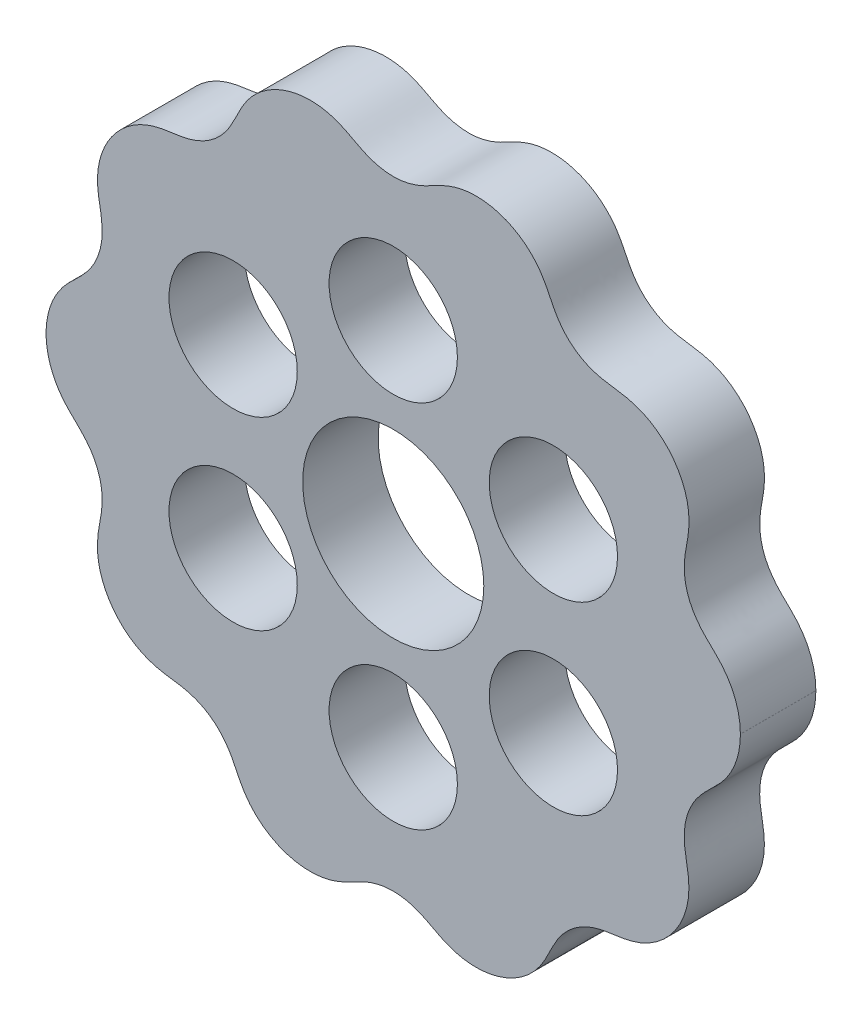
from build123d import *

# Parameters (mm, degrees)
BOSS_EXTRUDE1_DEPTH = 10
SKETCH2_R           = 8.5
SKETCH2_R_2         = 12
CUT_EXTRUDE1_DEPTH  = 10


# Read off the part's stored shape, not the designer's step: Boss-Extrude1
with BuildPart() as part:
    # Boss-Extrude1 outline → Boss-Extrude1 (new body)
    with BuildSketch(Plane.XY):
        with BuildLine():
            Line((45.999967847, -0.000808009), (45.999980979, 0.015150179))
            add(Edge.make_bspline(
                [(45.999980979, 0.015150179), (45.999909177, 0.043993275), (45.999533344, 0.092527615), (45.996854288, 0.26279134), (45.989395984, 0.511474453), (45.961346287, 0.964032972), (45.848010896, 1.928814687), (45.530838309, 3.24002273), (45.014894425, 4.484458229), (44.490203238, 5.414362), (44.040153464, 6.081697781), (43.52883506, 6.72519972), (43.03282734, 7.26431222), (42.556271955, 7.739280426), (42.124520249, 8.154065614), (41.570291561, 8.68967561), (40.906683081, 9.367491121), (40.173804604, 10.29356743), (39.560306261, 11.259421942), (38.995026481, 12.534542401), (38.657221475, 13.907340804), (38.554568486, 15.100977668), (38.587226765, 16.338371238), (38.726472717, 17.321095395), (38.862951715, 18.102405041), (38.970596798, 18.701092374), (39.052878567, 19.207851434), (39.135203938, 19.817778804), (39.193879544, 20.519678165), (39.200580554, 21.331321943), (39.143493661, 22.1306232), (38.982460709, 23.188133209), (38.622204628, 24.48640555), (37.944032589, 25.972584234), (37.039645341, 27.3414096), (35.93571982, 28.552474925), (34.665498832, 29.569797005), (33.499353595, 30.232659866), (32.51318542, 30.646101049), (31.746496478, 30.898075865), (30.928479523, 31.099228117), (30.177846556, 31.230700456), (29.414474723, 31.33806881), (28.701985949, 31.436495426), (27.84024195, 31.573845081), (26.820626562, 31.826888467), (25.838990356, 32.163305358), (24.662437059, 32.747964599), (23.504997603, 33.593007178), (22.591610581, 34.531924102), (21.772859937, 35.632013235), (21.239197537, 36.601197154), (20.862690475, 37.362728871), (20.587934907, 37.933016875), (20.27281516, 38.564369388), (19.916992674, 39.210623217), (19.465324173, 39.908992744), (18.978101745, 40.547585947), (18.442269866, 41.144650835), (17.6659664, 41.88154187), (16.582794133, 42.688378623), (15.134300839, 43.448289509), (13.58064433, 43.976350272), (11.967554224, 44.256915327), (10.614562099, 44.277932334), (9.548563777, 44.167343791), (8.759617074, 44.021057793), (7.985360328, 43.812563937), (7.215390848, 43.538319409), (6.558166399, 43.248361222), (5.981496328, 42.960692325), (5.493841027, 42.703386841), (4.881370359, 42.374313072), (4.043141573, 41.943977458), (2.819391337, 41.417606362), (1.260590771, 41.057202561), (-0.160841601, 40.960914901), (-1.535289477, 41.108637274), (-3.012575203, 41.49628454), (-4.137215587, 41.999777114), (-4.951720989, 42.421016744), (-5.533815758, 42.73494367), (-6.019337511, 42.989639414), (-6.589256211, 43.272106319), (-7.24313542, 43.55790297), (-8.014518722, 43.829000377), (-8.788845639, 44.03410691), (-9.578356934, 44.177062535), (-10.645151775, 44.283201632), (-11.998484636, 44.256618767), (-13.610648206, 43.969391712), (-15.162072329, 43.435081512), (-16.607284396, 42.669306079), (-17.686651175, 41.858334377), (-18.459642004, 41.118402865), (-18.993353295, 40.518625895), (-19.47785039, 39.878176776), (-19.927689091, 39.176582082), (-20.286146916, 38.520458945), (-20.600937017, 37.886416192), (-20.889081539, 37.288431925), (-21.277947915, 36.508345421), (-21.862330058, 35.473772303), (-22.757395347, 34.33340296), (-23.741957942, 33.391707519), (-24.926350035, 32.598212712), (-26.455787523, 31.905671864), (-27.803748907, 31.588306389), (-28.781781286, 31.432442151), (-29.475295234, 31.338869834), (-30.220519967, 31.232498276), (-30.966762182, 31.09969987), (-31.779857945, 30.896312301), (-32.545667663, 30.641186196), (-33.529382914, 30.223873985), (-34.693428516, 29.555788974), (-35.95963583, 28.533062778), (-37.058828978, 27.317277783), (-37.957522874, 25.944988268), (-38.629545092, 24.456156787), (-38.984206609, 23.156992822), (-39.140782965, 22.099068159), (-39.19459519, 21.298300118), (-39.184569333, 20.487909109), (-39.122921742, 19.781472122), (-39.037813564, 19.165346332), (-38.954143147, 18.656351085), (-38.841672749, 18.034965373), (-38.703691185, 17.228825261), (-38.563697037, 16.183296026), (-38.557936212, 14.864330444), (-38.704996539, 13.61944065), (-39.10477547, 12.236615358), (-39.69767808, 11.025919277), (-40.303468868, 10.127710565), (-41.005300019, 9.273039657), (-41.640690849, 8.632055422), (-42.174585459, 8.11830209), (-42.597256258, 7.71125793), (-43.067093697, 7.240843994), (-43.556227089, 6.705369209), (-44.066142184, 6.058533083), (-44.511686873, 5.391787911), (-45.033286281, 4.458008497), (-45.543743939, 3.214614794), (-45.91835428, 1.627153593), (-46.042364578, -0.008021821), (-45.912074809, -1.642660378), (-45.531454936, -3.228106152), (-45.016166243, -4.469261795), (-44.490948965, -5.400854029), (-44.04258997, -6.066038069), (-43.528660211, -6.713019947), (-43.036376726, -7.248448355), (-42.556422655, -7.726940173), (-42.126761597, -8.14020624), (-41.572000631, -8.676219906), (-40.904483147, -9.359999318), (-40.1760299, -10.281157695), (-39.558186524, -11.257131148), (-38.998220633, -12.524271934), (-38.659730437, -13.907384538), (-38.56006984, -15.090518607), (-38.592953656, -16.330455653), (-38.733471344, -17.311133438), (-38.868774447, -18.088432278), (-38.978074098, -18.69267491), (-39.05954078, -19.194432285), (-39.142098023, -19.804716519), (-39.201090693, -20.508941643), (-39.207949717, -21.317977576), (-39.150980992, -22.11852837), (-38.990186166, -23.175860629), (-38.630289044, -24.474108069), (-37.952371262, -25.960618853), (-37.0483698, -27.329533944), (-35.944635713, -28.540938483), (-34.674838032, -29.55843213), (-33.508411895, -30.221742609), (-32.52309764, -30.635132283), (-31.755255677, -30.887620613), (-30.939109877, -31.088606299), (-30.18545086, -31.220710702), (-29.425012376, -31.327973897), (-28.708580821, -31.427210986), (-27.847930179, -31.564712407), (-26.825849411, -31.819355599), (-25.844278949, -32.156720519), (-24.667177304, -32.743345587), (-23.50884523, -33.591542446), (-22.599888837, -34.528939023), (-21.783463691, -35.626864928), (-21.248740999, -36.600402323), (-20.877546028, -37.351200574), (-20.597847536, -37.932468904), (-20.287439747, -38.554902416), (-19.929320839, -39.20572596), (-19.478336401, -39.903434065), (-18.991583524, -40.541643202), (-18.455548488, -41.139233057), (-17.679472505, -41.876241382), (-16.596570231, -42.683245596), (-15.14816033, -43.443567037), (-13.5946696, -43.971938362), (-11.981644269, -44.252909595), (-10.628638345, -44.274199269), (-9.562562587, -44.163869765), (-8.773623789, -44.017772577), (-7.999930251, -43.809561909), (-7.228185918, -43.535020293), (-6.572022217, -43.245577556), (-5.996493759, -42.958537082), (-5.501632769, -42.698065587), (-4.901273807, -42.374985207), (-4.046701236, -41.938030242), (-2.836499421, -41.416426058), (-1.260148882, -41.054657075), (0.149462446, -40.961162928), (1.533141558, -41.111240417), (2.998599047, -41.498298527), (4.126260933, -42.002539841), (4.938798625, -42.423842851), (5.521241673, -42.73791555), (6.005751107, -42.992421134), (6.575391284, -43.274880963), (7.229663727, -43.560995633), (8.000258598, -43.832064602), (8.774876645, -44.037410225), (9.564293658, -44.180537137), (10.631060354, -44.286925077), (11.984428474, -44.260632272), (13.596623528, -43.973797386), (15.148230137, -43.439802008), (16.593519526, -42.674429787), (17.673156757, -41.863629935), (18.446384378, -41.123798314), (18.979842202, -40.524610603), (19.464925669, -39.883610966), (19.915310924, -39.18157966), (20.271349682, -38.530187302), (20.591422064, -37.886349523), (20.873541557, -37.301040869), (21.269809537, -36.507252338), (21.849891553, -35.48113889), (22.751853926, -34.333929258), (23.736159657, -33.395453618), (24.923834158, -32.601913158), (26.448141575, -31.914290533), (27.796346597, -31.597038542), (28.774592629, -31.441966708), (29.465423577, -31.348848968), (30.212336316, -31.242606139), (30.956316144, -31.110287953), (31.771032011, -30.906787396), (32.535791405, -30.652144727), (33.520317422, -30.23479375), (34.68410196, -29.567148415), (35.950728891, -28.544590947), (37.050111735, -27.329146349), (37.949193926, -25.956936574), (38.62146364, -24.46845069), (38.976486512, -23.169239427), (39.133299556, -22.111161207), (39.187221915, -21.311617782), (39.17737517, -20.498644637), (39.11599281, -19.794293066), (39.031202755, -19.179101293), (38.946497542, -18.663541503), (38.836189495, -18.050970772), (38.696453477, -17.236882881), (38.558120927, -16.191278403), (38.552599196, -14.874260749), (38.703038155, -13.61948214), (39.102413592, -12.245846031), (39.698557707, -11.03131911), (40.303052556, -10.137733066), (41.00525566, -9.283707901), (41.63893825, -8.645318438), (42.173725818, -8.130950151), (42.59591854, -7.724754571), (43.064470707, -7.255759028), (43.556058878, -6.718001209), (44.063792505, -6.074001771), (44.510962386, -5.405378474), (45.03198856, -4.472847368), (45.543025631, -3.229851698), (45.85573588, -1.903704468), (45.956628637, -1.029353519), (45.984186766, -0.614823429), (45.992944281, -0.429132939), (45.997835063, -0.241871794), (45.999852056, -0.076936406), (45.999998127, -0.02906758), (45.999967847, -0.000808009)],
                knots=[0.072195174, 0.072195174, 0.072195174, 0.072195174, 0.072612982, 0.073030789, 0.073866404, 0.075537634, 0.078880093, 0.085565011, 0.09224993, 0.095592389, 0.098934848, 0.102277307, 0.105619767, 0.107290996, 0.108962226, 0.110633455, 0.112304685, 0.1131403, 0.113975915, 0.114811529, 0.115647144, 0.116482759, 0.117318374, 0.118989603, 0.120660833, 0.122332063, 0.124003292, 0.125674522, 0.129016981, 0.13235944, 0.135701899, 0.139044359, 0.145729277, 0.152414196, 0.159099114, 0.165784032, 0.172468951, 0.179153869, 0.182496328, 0.185838788, 0.189181247, 0.192523706, 0.194194936, 0.195866165, 0.197537395, 0.19837301, 0.199208625, 0.200044239, 0.200879854, 0.201715469, 0.202551084, 0.204222313, 0.205893543, 0.207564773, 0.209236002, 0.212578461, 0.215920921, 0.21926338, 0.222605839, 0.225948298, 0.232633217, 0.239318135, 0.246003054, 0.252687972, 0.25937289, 0.26271535, 0.266057809, 0.269400268, 0.272742727, 0.276085186, 0.277756416, 0.279427646, 0.281098875, 0.282770105, 0.284441334, 0.285276949, 0.286112564, 0.286948179, 0.287783794, 0.289455023, 0.291126253, 0.292797483, 0.294468712, 0.296139942, 0.299482401, 0.30282486, 0.306167319, 0.309509779, 0.312852238, 0.319537156, 0.326222075, 0.332906993, 0.339591912, 0.34627683, 0.349619289, 0.352961748, 0.356304208, 0.359646667, 0.362989126, 0.364660356, 0.366331585, 0.368002815, 0.369674044, 0.370509659, 0.371345274, 0.372180889, 0.373016504, 0.374687733, 0.376358963, 0.378030192, 0.379701422, 0.383043881, 0.38638634, 0.3897288, 0.393071259, 0.399756177, 0.406441096, 0.413126014, 0.419810933, 0.426495851, 0.433180769, 0.436523229, 0.439865688, 0.443208147, 0.446550606, 0.448221836, 0.449893066, 0.451564295, 0.453235525, 0.454906754, 0.455742369, 0.456577984, 0.457413599, 0.458249214, 0.459084828, 0.459920443, 0.461591673, 0.463262902, 0.464934132, 0.466605362, 0.469947821, 0.47329028, 0.476632739, 0.479975198, 0.486660117, 0.493345035, 0.500029954, 0.506714872, 0.513399791, 0.520084709, 0.523427168, 0.526769627, 0.530112087, 0.533454546, 0.535125776, 0.536797005, 0.538468235, 0.540139464, 0.540975079, 0.541810694, 0.542646309, 0.543481924, 0.544317538, 0.545153153, 0.546824383, 0.548495612, 0.550166842, 0.551838072, 0.553509301, 0.55685176, 0.56019422, 0.563536679, 0.566879138, 0.573564056, 0.580248975, 0.586933893, 0.593618812, 0.60030373, 0.606988649, 0.610331108, 0.613673567, 0.617016026, 0.620358485, 0.622029715, 0.623700945, 0.625372174, 0.626207789, 0.627043404, 0.627879019, 0.628714634, 0.629550248, 0.630385863, 0.632057093, 0.633728322, 0.635399552, 0.637070782, 0.640413241, 0.6437557, 0.647098159, 0.650440618, 0.653783078, 0.660467996, 0.667152914, 0.673837833, 0.680522751, 0.68720767, 0.690550129, 0.693892588, 0.697235047, 0.700577507, 0.703919966, 0.705591195, 0.707262425, 0.708933655, 0.710604884, 0.712276114, 0.713111729, 0.713947343, 0.714782958, 0.715618573, 0.717289803, 0.718961032, 0.720632262, 0.722303492, 0.723974721, 0.72731718, 0.73065964, 0.734002099, 0.737344558, 0.740687017, 0.747371936, 0.754056854, 0.760741772, 0.767426691, 0.774111609, 0.777454069, 0.780796528, 0.784138987, 0.787481446, 0.790823905, 0.792495135, 0.794166365, 0.795837594, 0.797508824, 0.798344439, 0.799180053, 0.800015668, 0.800851283, 0.802522513, 0.804193742, 0.805864972, 0.807536201, 0.810878661, 0.81422112, 0.817563579, 0.820906038, 0.827590957, 0.834275875, 0.840960794, 0.847645712, 0.85433063, 0.861015549, 0.864358008, 0.867700467, 0.871042927, 0.874385386, 0.876056615, 0.877727845, 0.879399075, 0.881070304, 0.882741534, 0.883577149, 0.884412763, 0.885248378, 0.886083993, 0.886919608, 0.887755223, 0.889426452, 0.891097682, 0.892768911, 0.894440141, 0.8977826, 0.901125059, 0.904467519, 0.907809978, 0.914494896, 0.921179815, 0.924522274, 0.925357889, 0.926193504, 0.927029118, 0.927446926, 0.927864733, 0.927864733, 0.927864733, 0.927864733], degree=3))
        make_face()
    extrude(amount=BOSS_EXTRUDE1_DEPTH)

    # Sketch2 → Cut-Extrude1 (cut)
    with BuildSketch(Plane.XY.offset(10)):
        with Locations((0, 24.5)):
            Circle(SKETCH2_R)
        with Locations((21.217622393, 12.25)):
            Circle(SKETCH2_R)
        with Locations((21.217622393, -12.25)):
            Circle(SKETCH2_R)
        with Locations((0, -24.5)):
            Circle(SKETCH2_R)
        with Locations((-21.217622393, -12.25)):
            Circle(SKETCH2_R)
        with Locations((-21.217622393, 12.25)):
            Circle(SKETCH2_R)
        Circle(SKETCH2_R_2)
    extrude(amount=-CUT_EXTRUDE1_DEPTH, mode=Mode.SUBTRACT)


solid = part.part
